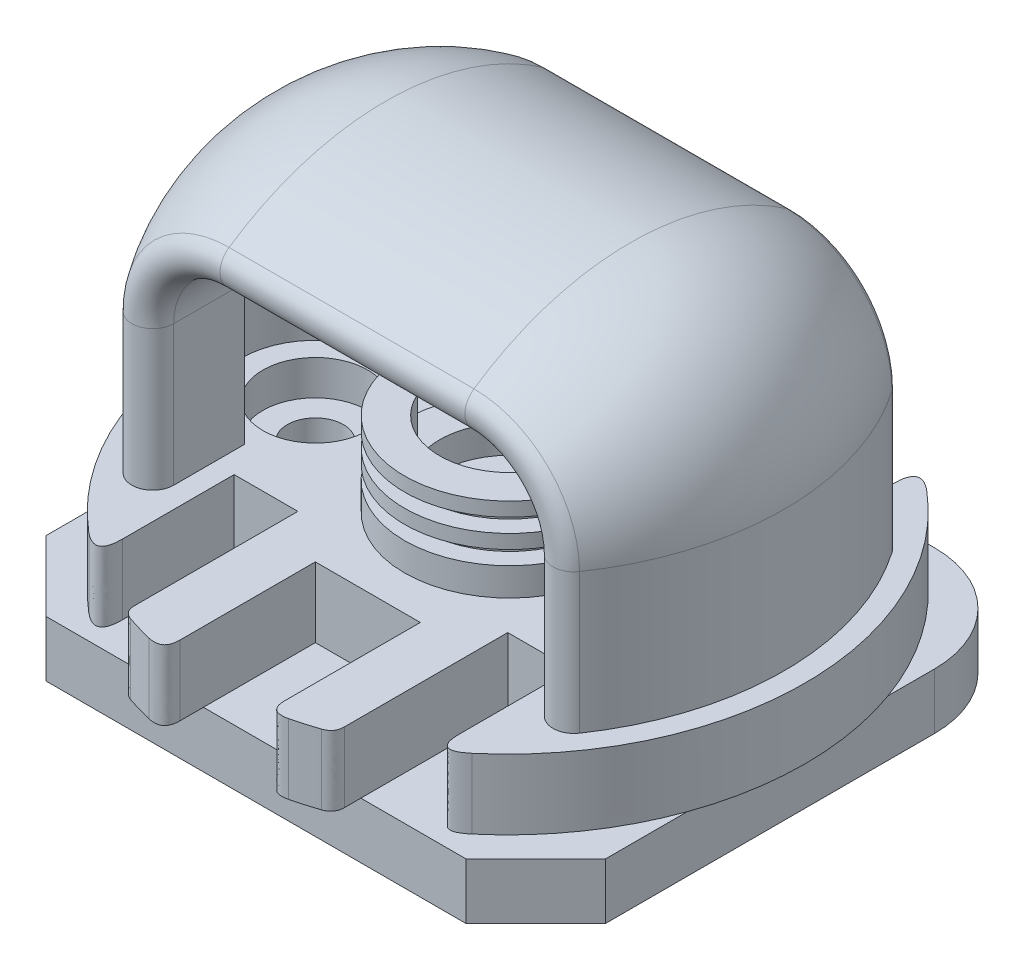
from build123d import *

# Parameters (mm, degrees)
SKETCH2_W                                = 80
SKETCH2_H                                = 72
BOSS_EXTRUDE1_DEPTH                      = 8
BOSS_EXTRUDE2_DEPTH                      = 10
CHAMFER1_SIZE                            = 10
FILLET1_R                                = 15
SKETCH4_R                                = 15
SKETCH4_R_2                              = 10
BOSS_EXTRUDE3_DEPTH                      = 12
SKETCH5_W                                = 8
SKETCH5_H                                = 8
CUT_EXTRUDE1_DEPTH                       = 114.535236821
CBORE_FOR_M10_HEX_HEAD_BOLT1_D           = 8
CBORE_FOR_M10_HEX_HEAD_BOLT1_CBORE_D     = 15
CBORE_FOR_M10_HEX_HEAD_BOLT1_CBORE_DEPTH = 5
SKETCH9_R                                = 7
CUT_EXTRUDE3_DEPTH                       = 5
CUT_EXTRUDE4_START                       = -4
CUT_EXTRUDE4_DEPTH                       = 2
LPATTERN1_COUNT                          = 2
LPATTERN1_PITCH                          = 4


with BuildPart() as part:
    # Sketch2 → Boss-Extrude1 (new body)
    with BuildSketch(Plane(origin=(0, 0, 0), x_dir=(1, 0, 0), z_dir=(0, 1, 0))):
        with Locations((40, 36)):
            Rectangle(SKETCH2_W, SKETCH2_H)
    extrude(amount=BOSS_EXTRUDE1_DEPTH)

    # Sketch3 → Boss-Extrude2 (add)
    with BuildSketch(Plane(origin=(0, 8, 0), x_dir=(1, 0, 0), z_dir=(0, 1, 0))):
        with BuildLine():
            Line((32.5, 65.047375097), (32.5, 56))
            Line((32.5, 56), (47.5, 56))
            Line((47.5, 56), (47.5, 65.047375097))
            ThreePointArc((47.5, 65.047375097), (51.354009371, 63.768443802), (55, 61.980762114))
            Line((55, 61.980762114), (55, 51))
            Line((55, 51), (64.109126902, 51))
            Line((64.109126902, 51), (64.109126902, 71))
            ThreePointArc((64.109126902, 71), (82.5, 36), (64.109126902, 1))
            Line((64.109126902, 1), (64.109126902, 21))
            Line((64.109126902, 21), (55, 21))
            Line((55, 21), (55, -3.764934301))
            ThreePointArc((55, -3.764934301), (51.297421179, -4.970944274), (47.5, -5.833001327))
            Line((47.5, -5.833001327), (47.5, 16))
            Line((47.5, 16), (32.5, 16))
            Line((32.5, 16), (32.5, -5.833001327))
            ThreePointArc((32.5, -5.833001327), (28.702578821, -4.970944274), (25, -3.764934301))
            Line((25, -3.764934301), (25, 21))
            Line((25, 21), (15.890873098, 21))
            Line((15.890873098, 21), (15.890873098, 1))
            ThreePointArc((15.890873098, 1), (-2.5, 36), (15.890873098, 71))
            Line((15.890873098, 71), (15.890873098, 51))
            Line((15.890873098, 51), (25, 51))
            Line((25, 51), (25, 61.980762114))
            ThreePointArc((25, 61.980762114), (28.645990629, 63.768443802), (32.5, 65.047375097))
        make_face()
    extrude(amount=BOSS_EXTRUDE2_DEPTH)

    # Chamfer1
    chamfer1_edges = [part.edges().sort_by_distance(p)[0] for p in [
        (80, 4, 0),
        (0, 4, 0),
    ]]
    chamfer(chamfer1_edges, length=CHAMFER1_SIZE)

    # Fillet1
    fillet1_edges = [part.edges().sort_by_distance(p)[0] for p in [
        (0, 4, -72),
        (80, 4, -72),
    ]]
    fillet(fillet1_edges, radius=FILLET1_R)

    # Sketch4 → Boss-Extrude3 (add)
    with BuildSketch(Plane(origin=(0, 18, 0), x_dir=(1, 0, 0), z_dir=(0, 1, 0))):
        with Locations(Location((40.253775516, 36, 0), (0, 0, 270))):
            Circle(SKETCH4_R)
        with Locations(Location((40.253775516, 36, 0), (0, 0, 270))):
            Circle(SKETCH4_R_2, mode=Mode.SUBTRACT)
    extrude(amount=BOSS_EXTRUDE3_DEPTH)

    # Sketch5 → Cut-Extrude1 (cut, through all)
    with BuildSketch(Plane(origin=(0, 0, 0), x_dir=(0, 0, -1), z_dir=(1, 0, 0))):
        with Locations((36, 26)):
            Rectangle(SKETCH5_W, SKETCH5_H)
    extrude(amount=CUT_EXTRUDE1_DEPTH, mode=Mode.SUBTRACT)

    # CBORE for M10 Hex Head Bolt1 (through all)
    with Locations(Plane(origin=(0, 18, 0), x_dir=(1, 0, 0), z_dir=(0, 1, 0))):
        with Locations((67.5, 36), (12.5, 36)):
            CounterBoreHole(CBORE_FOR_M10_HEX_HEAD_BOLT1_D / 2, CBORE_FOR_M10_HEX_HEAD_BOLT1_CBORE_D / 2, CBORE_FOR_M10_HEX_HEAD_BOLT1_CBORE_DEPTH)

    # Fillet2
    # a fillet whose section is not a circle: 2 mm, written as the material it takes off along each edge
    with BuildSketch(Plane(origin=(64.109126902, 8, -71), x_dir=(0.7949377645481589, 0, 0.6066909843529702), z_dir=(0, 1, 0)), Plane(origin=(15.890873098, 8, -1), x_dir=(-0.7949377645481593, 0, -0.6066909843529693), z_dir=(0, 1, 0))) as fillet2_piece_1:
        with BuildLine():
            Bezier((4.137858015, 0), (-0.159861677, 0.20946427), (2.45062112, -3.211010754), weights=[1, 1, 1])
            Line((2.45062112, -3.211010754), (0, 0))
            ThreePointArc((0, 0), (2.068929007, 0.050388308), (4.137858015, 0))
        make_face()
    extrude(amount=20.344645036, mode=Mode.SUBTRACT)
    with BuildSketch(Plane(origin=(15.890873098, 8, -71), x_dir=(-0.794937764548161, 0, 0.6066909843529674), z_dir=(0, 1, 0)), Plane(origin=(64.109126902, 8, -1), x_dir=(0.7949377645481593, 0, -0.6066909843529698), z_dir=(0, 1, 0))) as fillet2_piece_2:
        with BuildLine():
            Bezier((4.137858015, 0), (-0.159861677, -0.20946427), (2.45062112, 3.211010754), weights=[1, 1, 1])
            Line((2.45062112, 3.211010754), (0, 0))
            ThreePointArc((0, 0), (2.068929007, -0.050388308), (4.137858015, 0))
        make_face()
    extrude(amount=20.344645036, mode=Mode.SUBTRACT)
    with BuildSketch(Plane(origin=(55, 4.393986535, 3.764934301), x_dir=(0, 0, -1), z_dir=(0, 1, 0))) as fillet2_piece_3:
        with BuildLine():
            Bezier((1.408057473, 0), (-0.025844464, 0), (-0.486109283, 1.358024691), weights=[1, 1, 1])
            ThreePointArc((-0.486109283, 1.358024691), (-0.248816298, 0.676949942), (0, 0))
            Line((0, 0), (1.408057473, 0))
        make_face()
    extrude(amount=17.21202693, mode=Mode.SUBTRACT)
    with BuildSketch(Plane(origin=(47.5, 1.692392429, 5.833001327), x_dir=(0, 0, -1), z_dir=(0, 1, 0))) as fillet2_piece_4:
        with BuildLine():
            Bezier((2.462961957, 0), (-0.077040583, 0), (0.518762482, -2.469135802), weights=[1, 1, 1])
            ThreePointArc((0.518762482, -2.469135802), (0.241054451, -1.238418338), (0, 0))
            Line((0, 0), (2.462961957, 0))
        make_face()
    extrude(amount=22.615215142, mode=Mode.SUBTRACT)
    with BuildSketch(Plane(origin=(32.5, 1.692392429, 5.833001327), x_dir=(-0.9786340441453191, 0, -0.20560984324632356), z_dir=(0, 1, 0))) as fillet2_piece_5:
        with BuildLine():
            Bezier((2.523043028, 0), (-0.015840302, 0.075394538), (0.506409222, -2.41033842), weights=[1, 1, 1])
            Line((0.506409222, -2.41033842), (0, 0))
            ThreePointArc((0, 0), (1.261521514, 0.018726909), (2.523043028, 0))
        make_face()
    extrude(amount=22.615215142, mode=Mode.SUBTRACT)
    with BuildSketch(Plane(origin=(25, 4.393986535, 3.764934301), x_dir=(0, 0, -1), z_dir=(0, 1, 0))) as fillet2_piece_6:
        with BuildLine():
            Bezier((1.408057473, 0), (-0.025844464, 0), (-0.486109283, -1.358024691), weights=[1, 1, 1])
            ThreePointArc((-0.486109283, -1.358024691), (-0.248816298, -0.676949942), (0, 0))
            Line((0, 0), (1.408057473, 0))
        make_face()
    extrude(amount=17.21202693, mode=Mode.SUBTRACT)
    with BuildSketch(Plane(origin=(55, 8, -61.980762114), x_dir=(0, 0, 1), z_dir=(0, 1, 0))) as fillet2_piece_7:
        with BuildLine():
            Bezier((1.181568578, 0), (-0.02814818, 0), (-0.589802389, -1.071428571), weights=[1, 1, 1])
            ThreePointArc((-0.589802389, -1.071428571), (-0.30036176, -0.532708341), (0, 0))
            Line((0, 0), (1.181568578, 0))
        make_face()
    extrude(amount=13.057599182, mode=Mode.SUBTRACT)
    with BuildSketch(Plane(origin=(47.5, 8, -65.047375097), x_dir=(0, 0, 1), z_dir=(0, 1, 0))) as fillet2_piece_8:
        with BuildLine():
            Bezier((2.708240714, 0), (-0.139233273, 0), (0.826873973, 2.678571429), weights=[1, 1, 1])
            ThreePointArc((0.826873973, 2.678571429), (0.382133114, 1.348949208), (0, 0))
            Line((0, 0), (2.708240714, 0))
        make_face()
    extrude(amount=17.008238663, mode=Mode.SUBTRACT)
    with BuildSketch(Plane(origin=(32.5, 8, -65.047375097), x_dir=(-0.9555080660857783, 0, 0.294964973590113), z_dir=(0, 1, 0))) as fillet2_piece_9:
        with BuildLine():
            Bezier((2.803295465, 0), (-0.041068939, -0.133038515), (0.798836151, 2.587745848), weights=[1, 1, 1])
            Line((0.798836151, 2.587745848), (0, 0))
            ThreePointArc((0, 0), (1.401647733, -0.032761495), (2.803295465, 0))
        make_face()
    extrude(amount=17.008238663, mode=Mode.SUBTRACT)
    with BuildSketch(Plane(origin=(25, 8, -61.980762114), x_dir=(0, 0, 1), z_dir=(0, 1, 0))) as fillet2_piece_10:
        with BuildLine():
            Bezier((1.181568578, 0), (-0.02814818, 0), (-0.589802389, 1.071428571), weights=[1, 1, 1])
            ThreePointArc((-0.589802389, 1.071428571), (-0.30036176, 0.532708341), (0, 0))
            Line((0, 0), (1.181568578, 0))
        make_face()
    extrude(amount=13.057599182, mode=Mode.SUBTRACT)

    # Sketch9 → Cut-Extrude3 (cut)
    with BuildSketch(Plane.XZ):
        with BuildLine():
            Line((77, -11.242640687), (68.757359313, -3))
            Line((68.757359313, -3), (11.242640687, -3))
            Line((11.242640687, -3), (3, -11.242640687))
            Line((3, -11.242640687), (3, -57))
            ThreePointArc((3, -57), (6.514718626, -65.485281374), (15, -69))
            Line((15, -69), (65, -69))
            ThreePointArc((65, -69), (73.485281374, -65.485281374), (77, -57))
            Line((77, -57), (77, -11.242640687))
        make_face()
        with Locations(Location((67.5, -36, 0), (0, 0, 270))):
            Circle(SKETCH9_R, mode=Mode.SUBTRACT)
        with Locations(Location((12.5, -36, 0), (0, 0, 270))):
            Circle(SKETCH9_R, mode=Mode.SUBTRACT)
    extrude(amount=-CUT_EXTRUDE3_DEPTH, mode=Mode.SUBTRACT)

    # Sketch10 → Cut-Extrude4 (cut)
    with BuildSketch(Plane(origin=(0, 30, 0), x_dir=(1, 0, 0), z_dir=(0, 1, 0)).offset(CUT_EXTRUDE4_START)):
        with BuildLine():
            ThreePointArc((52.096494798, 40), (52.588360856, 38.026821276), (52.753775516, 36))
            ThreePointArc((52.753775516, 36), (38.22695424, 23.66541466), (28.411056234, 40))
            Line((28.411056234, 40), (25.796943221, 40))
            ThreePointArc((25.796943221, 40), (38.235420297, 21.136412203), (55.253775516, 36))
            ThreePointArc((55.253775516, 36), (55.117363314, 38.018355219), (54.710607811, 40))
            Line((54.710607811, 40), (52.096494798, 40))
        make_face()
        with BuildLine():
            ThreePointArc((28.411056234, 40), (40.253775516, 48.5), (52.096494798, 40))
            Line((52.096494798, 40), (54.710607811, 40))
            ThreePointArc((54.710607811, 40), (40.253775516, 51), (25.796943221, 40))
            Line((25.796943221, 40), (28.411056234, 40))
        make_face()
    cut_extrude4 = extrude(amount=CUT_EXTRUDE4_DEPTH, mode=Mode.SUBTRACT)

    # LPattern1: Cut-Extrude4 ×2
    with Locations(*[(0, -i * LPATTERN1_PITCH, 0) for i in range(1, LPATTERN1_COUNT)]):
        add(cut_extrude4, mode=Mode.SUBTRACT)

    # Sweep2: sweep along a path in Sketch12
    with BuildLine(Plane.XY.offset(-36)) as sweep2_path:
        Line((67.5, 18), (67.5, 38))
        ThreePointArc((67.5, 38), (64.571067812, 45.071067812), (57.5, 48))
        Line((57.5, 48), (22.5, 48))
        ThreePointArc((22.5, 48), (15.428932188, 45.071067812), (12.5, 38))
        Line((12.5, 38), (12.5, 18))
    # Sketch11 → Sweep2 (sweep)
    with BuildSketch(Plane(origin=(0, 18, 0), x_dir=(1, 0, 0), z_dir=(0, 1, 0))):
        with BuildLine():
            Line((67.109126902, 25.507277845), (67.109126902, 15.367732137))
            ThreePointArc((67.109126902, 15.367732137), (69.221480655, 12.502058719), (72.583849662, 13.671929299))
            ThreePointArc((72.583849662, 13.671929299), (79.5, 36), (72.583849662, 58.328070701))
            ThreePointArc((72.583849662, 58.328070701), (69.221480655, 59.497941281), (67.109126902, 56.632267863))
            Line((67.109126902, 56.632267863), (67.109126902, 46.492722155))
            ThreePointArc((67.109126902, 46.492722155), (78, 36), (67.109126902, 25.507277845))
        make_face()
    sweep(path=sweep2_path.line)


solid = part.part
